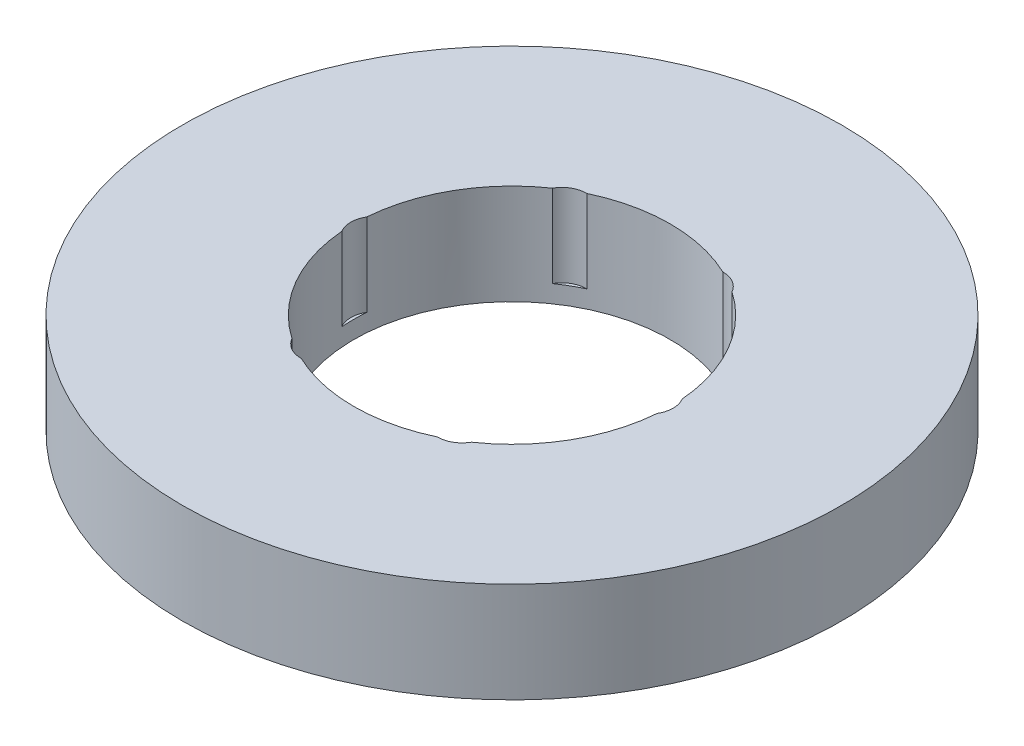
from build123d import *

# Parameters (mm, degrees)
SKETCH1_R           = 62.5
BOSS_EXTRUDE1_DEPTH = 19
SKETCH2_R           = 30
CUT_EXTRUDE1_DEPTH  = 91.407411201
SKETCH3_R           = 4.652751858
CUT_EXTRUDE2_DEPTH  = 15.675333749
CIRPATTERN1_COUNT   = 6


with BuildPart() as part:
    # Sketch1 → Boss-Extrude1 (new body)
    with BuildSketch(Plane(origin=(0, 0, 0), x_dir=(1, 0, 0), z_dir=(0, 1, 0))):
        Circle(SKETCH1_R)
    extrude(amount=BOSS_EXTRUDE1_DEPTH)

    # Sketch2 → Cut-Extrude1 (cut, through all)
    with BuildSketch(Plane(origin=(0, 0, 0), x_dir=(1, 0, 0), z_dir=(0, 1, 0))):
        Circle(SKETCH2_R)
    extrude(amount=CUT_EXTRUDE1_DEPTH, mode=Mode.SUBTRACT)

    # Sketch3 → Cut-Extrude2 (cut)
    with BuildSketch(Plane(origin=(0, 19, 0), x_dir=(1, 0, 0), z_dir=(0, 1, 0))):
        with Locations((-25.907314941, 0)):
            Circle(SKETCH3_R)
    cut_extrude2 = extrude(amount=-CUT_EXTRUDE2_DEPTH, mode=Mode.SUBTRACT)

    # CirPattern1: Cut-Extrude2 ×6 about axis
    cirpattern1_axis = Axis((0, 0, 0), (0, 1, 0))
    for i in range(1, CIRPATTERN1_COUNT):
        add(cut_extrude2.rotate(cirpattern1_axis, i * 360 / CIRPATTERN1_COUNT), mode=Mode.SUBTRACT)


solid = part.part
